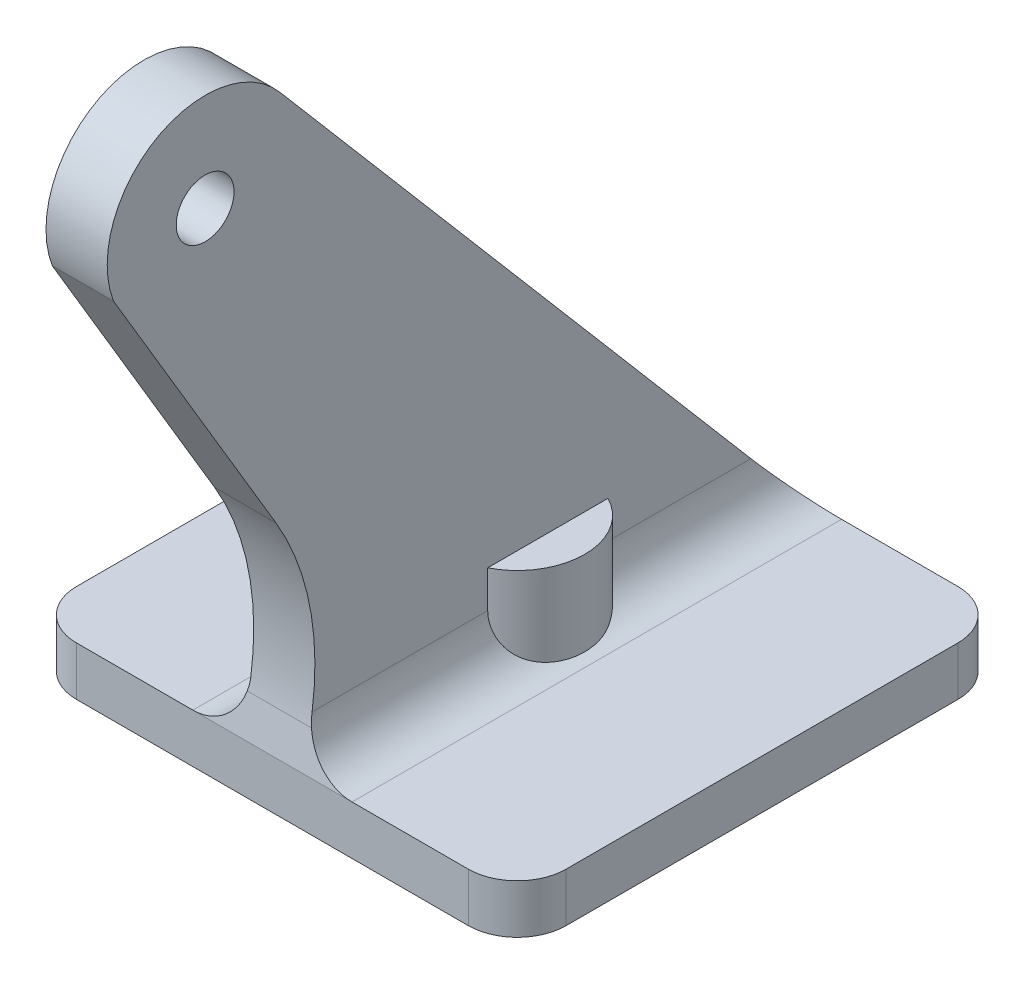
from build123d import *

# Parameters (mm, degrees)
SKETCH1_W           = 25.4
SKETCH1_H           = 25.4
BOSS_EXTRUDE1_DEPTH = 2.54
SKETCH3_R           = 1.5
BOSS_EXTRUDE2_DEPTH = 1.5875
FILLET1_START       = -12.7000001
FILLET1_DEPTH       = 25.4000001
FILLET1_START_2     = -5
FILLET1_2_DEPTH     = 10
FILLET2_R           = 2.54
SKETCH4_R           = 3.5
BOSS_EXTRUDE3_DEPTH = 7
SKETCH5_R           = 1.25
CUT_EXTRUDE1_DEPTH  = 6.35


with BuildPart() as part:
    # Sketch1 → Boss-Extrude1 (new body)
    with BuildSketch(Plane(origin=(0, 0, 0), x_dir=(1, 0, 0), z_dir=(0, 1, 0))):
        Rectangle(SKETCH1_W, SKETCH1_H)
    extrude(amount=BOSS_EXTRUDE1_DEPTH)

    # Sketch3 → Boss-Extrude2 (add, symmetric)
    with BuildSketch(Plane(origin=(0, 0, 0), x_dir=(0, 0, -1), z_dir=(1, 0, 0))):
        with BuildLine():
            Line((-22.53488, 28.69184), (-14.109077454, 14.518123111))
            ThreePointArc((-14.109077454, 14.518123111), (-12.301446379, 9.646212675), (-12.336895325, 4.449888515))
            Line((-12.336895325, 4.449888515), (-12.7, 2.54))
            Line((-12.7, 2.54), (12.7, 2.54))
            Line((12.7, 2.54), (-13.91324895, 33.774637509))
            ThreePointArc((-13.91324895, 33.774637509), (-20.359903271, 34.856128324), (-22.53488, 28.69184))
        make_face()
        with Locations((-17.78, 30.48)):
            Circle(SKETCH3_R, mode=Mode.SUBTRACT)
    extrude(amount=BOSS_EXTRUDE2_DEPTH, both=True)

    # Fillet1: read off the stored shape, not the designer's step
    # Fillet1 outline → Fillet1 (add)
    with BuildSketch(Plane.XY.offset(FILLET1_START)):
        with BuildLine():
            ThreePointArc((-1.5875, 5.08), (-2.331448776, 3.283948776), (-4.1275, 2.54))
            Line((-4.1275, 2.54), (-1.5875, 2.54))
            Line((-1.5875, 2.54), (-1.5875, 5.08))
        make_face()
        with BuildLine():
            Line((1.5875, 2.54), (4.1275, 2.54))
            ThreePointArc((4.1275, 2.54), (2.331448776, 3.283948776), (1.5875, 5.08))
            Line((1.5875, 5.08), (1.5875, 2.54))
        make_face()
    extrude(amount=FILLET1_DEPTH)

    # Fillet1 2 outline → Fillet1 2 (cut)
    with BuildSketch(Plane.YZ.offset(FILLET1_START_2)):
        Polygon((5.08, -10.535811211), (2.54, -12.7), (5.08, -12.7000001), align=None)
        with BuildLine():
            Line((5.08, 12.7), (2.54, 12.7))
            Line((2.54, 12.7), (4.449888515, 12.336895325))
            ThreePointArc((4.449888515, 12.336895325), (4.764360857, 12.280707955), (5.08, 12.231496116))
            Line((5.08, 12.231496116), (5.08, 12.7))
        make_face()
    extrude(amount=FILLET1_2_DEPTH, mode=Mode.SUBTRACT)

    # Fillet2
    fillet2_edges = [part.edges().sort_by_distance(p)[0] for p in [
        (12.7, 1.27, -12.7),
        (12.7, 1.27, 12.7),
        (-12.7, 1.27, 12.7),
        (-12.7, 1.27, -12.7),
    ]]
    fillet(fillet2_edges, radius=FILLET2_R)

    # Sketch4 → Boss-Extrude3 (add)
    with BuildSketch(Plane.XZ):
        Circle(SKETCH4_R)
    extrude(amount=-BOSS_EXTRUDE3_DEPTH)

    # Sketch5 → Cut-Extrude1 (cut)
    with BuildSketch(Plane.XZ):
        with Locations(Location((0, 0, 0), (0, 0, 270))):
            Circle(SKETCH5_R)
    extrude(amount=-CUT_EXTRUDE1_DEPTH, mode=Mode.SUBTRACT)


solid = part.part
